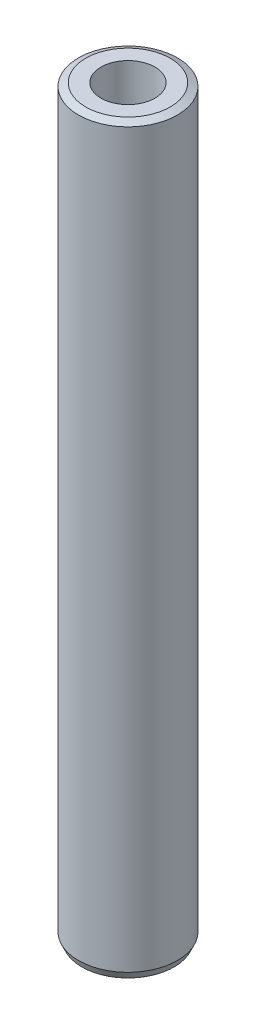
from build123d import *
from OCP.BRepFilletAPI import BRepFilletAPI_MakeChamfer

# Parameters (mm, degrees)
SKETCH1_R           = 40
BOSS_EXTRUDE1_DEPTH = 600
SKETCH2_R           = 21.8086135
CUT_EXTRUDE1_DEPTH  = 603.660766933
CHAMFER1_SIZE       = 2.681235945
CHAMFER1_SIZE2      = 5.875379052


with BuildPart() as part:
    # Sketch1 → Boss-Extrude1 (new body)
    with BuildSketch(Plane(origin=(0, 0, 0), x_dir=(1, 0, 0), z_dir=(0, 1, 0))):
        Circle(SKETCH1_R)
    extrude(amount=BOSS_EXTRUDE1_DEPTH)

    # Sketch2 → Cut-Extrude1 (cut, through all)
    with BuildSketch(Plane(origin=(0, 0, 0), x_dir=(1, 0, 0), z_dir=(0, 1, 0))):
        Circle(SKETCH2_R)
    extrude(amount=CUT_EXTRUDE1_DEPTH, mode=Mode.SUBTRACT)

    # Chamfer1: one chamfer whose edges measure the first distance from different faces: ONE call of the kernel's chamfer builder (chamfer() names one face for all edges)
    chamfer1_edges_1 = [part.edges().sort_by_distance(p)[0] for p in [
        (-40, 600, 0),
    ]]
    chamfer1_side_1 = [part.faces().sort_by_distance(p)[0] for p in [
        (-40, 300, 0),
    ]]
    chamfer1_edges_2 = [part.edges().sort_by_distance(p)[0] for p in [
        (-40, 0, 0),
    ]]
    chamfer1_side_2 = [part.faces().sort_by_distance(p)[0] for p in [
        (-38.86862915, 0, 0),
    ]]
    chamfer1 = BRepFilletAPI_MakeChamfer(part.part.solid().wrapped)
    for e in chamfer1_edges_1:
        chamfer1.Add(CHAMFER1_SIZE, CHAMFER1_SIZE2, e.wrapped, chamfer1_side_1[0].wrapped)  # the first distance lies on this face
    for e in chamfer1_edges_2:
        chamfer1.Add(CHAMFER1_SIZE, CHAMFER1_SIZE2, e.wrapped, chamfer1_side_2[0].wrapped)  # the first distance lies on this face
    add(Compound.cast(chamfer1.Shape()), mode=Mode.REPLACE)


solid = part.part
